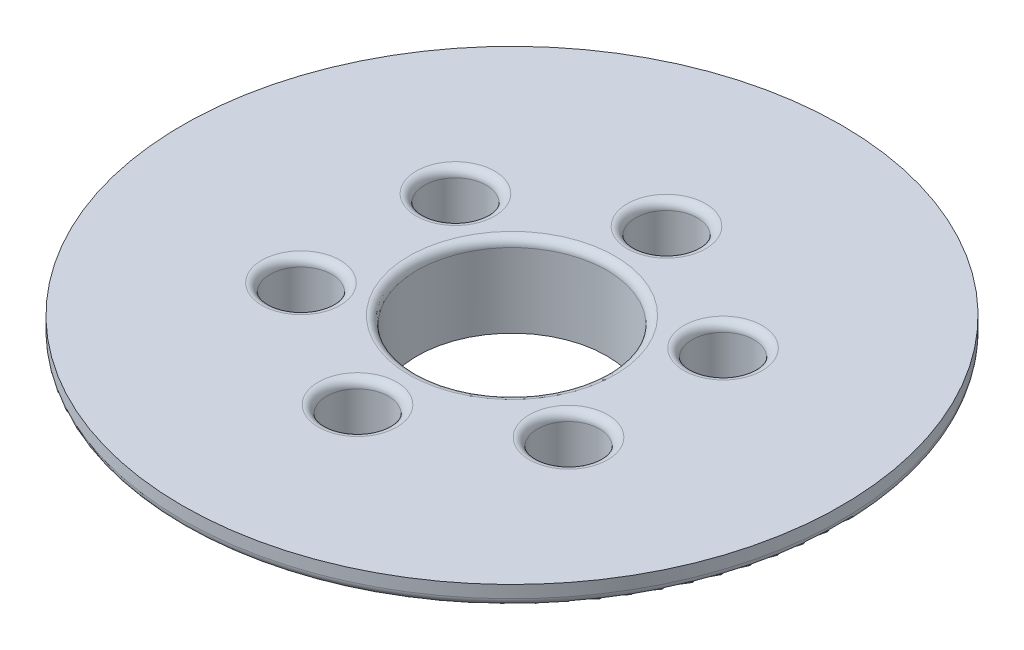
from build123d import *

# Parameters (mm, degrees)
SKETCH1_R           = 31.75
SKETCH1_R_2         = 29.21
BOSS_EXTRUDE1_DEPTH = 3.175
SKETCH2_R           = 31.75
BOSS_EXTRUDE2_DEPTH = 9.525
SKETCH3_R           = 14.605
CUT_EXTRUDE1_DEPTH  = 46.900442536
SKETCH4_R           = 50.8
SKETCH4_R_2         = 14.605
RIM_DEPTH           = 3.175
SKETCH5_R           = 2.667
CUT_EXTRUDE_R_DEPTH = 73.955945611
SKETCH6_R           = 4.7625
CUT_EXTRUDE3_DEPTH  = 8.255
FILLET1_R           = 1.27


with BuildPart() as part:
    # Sketch1 → Boss-Extrude1 (new body)
    with BuildSketch(Plane(origin=(0, 0, 0), x_dir=(1, 0, 0), z_dir=(0, 1, 0))):
        Circle(SKETCH1_R)
        Circle(SKETCH1_R_2, mode=Mode.SUBTRACT)
    extrude(amount=BOSS_EXTRUDE1_DEPTH)

    # Sketch2 → Boss-Extrude2 (add)
    with BuildSketch(Plane(origin=(0, 3.175, 0), x_dir=(1, 0, 0), z_dir=(0, 1, 0))):
        Circle(SKETCH2_R)
    extrude(amount=BOSS_EXTRUDE2_DEPTH)

    # Sketch3 → Cut-Extrude1 (cut, through all)
    with BuildSketch(Plane.XZ.offset(-3.175)):
        Circle(SKETCH3_R)
    extrude(amount=-CUT_EXTRUDE1_DEPTH, mode=Mode.SUBTRACT)

    # Sketch4 → Rim (add)
    with BuildSketch(Plane(origin=(0, 12.7, 0), x_dir=(1, 0, 0), z_dir=(0, 1, 0))):
        Circle(SKETCH4_R)
        Circle(SKETCH4_R_2, mode=Mode.SUBTRACT)
    extrude(amount=RIM_DEPTH)

    # Sketch5 → Cut-Extrude r (cut, through all)
    with BuildSketch(Plane.XZ.offset(-3.175)):
        with Locations((0, 23.8125)):
            Circle(SKETCH5_R)
        with Locations((20.622229928, 11.90625)):
            Circle(SKETCH5_R)
        with Locations((20.622229928, -11.90625)):
            Circle(SKETCH5_R)
        with Locations((0, -23.8125)):
            Circle(SKETCH5_R)
        with Locations((-20.622229928, -11.90625)):
            Circle(SKETCH5_R)
        with Locations((-20.622229928, 11.90625)):
            Circle(SKETCH5_R)
    extrude(amount=-CUT_EXTRUDE_R_DEPTH, mode=Mode.SUBTRACT)

    # Sketch6 → Cut-Extrude3 (cut)
    with BuildSketch(Plane(origin=(0, 15.875, 0), x_dir=(1, 0, 0), z_dir=(0, 1, 0))):
        with Locations((20.622229928, -11.90625)):
            Circle(SKETCH6_R)
        with Locations((0, -23.8125)):
            Circle(SKETCH6_R)
        with Locations((-20.622229928, -11.90625)):
            Circle(SKETCH6_R)
        with Locations((-20.622229928, 11.90625)):
            Circle(SKETCH6_R)
        with Locations((0, 23.8125)):
            Circle(SKETCH6_R)
        with Locations((20.622229928, 11.90625)):
            Circle(SKETCH6_R)
    extrude(amount=-CUT_EXTRUDE3_DEPTH, mode=Mode.SUBTRACT)

    # Fillet1
    fillet1_edges = [part.edges().sort_by_distance(p)[0] for p in [
        (-14.605, 15.875, 0),
        (-4.7625, 15.875, 23.8125),
        (-25.384729928, 15.875, 11.90625),
        (-25.384729928, 15.875, -11.90625),
        (-4.7625, 15.875, -23.8125),
        (15.859729928, 15.875, 11.90625),
        (15.859729928, 15.875, -11.90625),
        (-50.8, 12.7, 0),
    ]]
    fillet(fillet1_edges, radius=FILLET1_R)


solid = part.part
